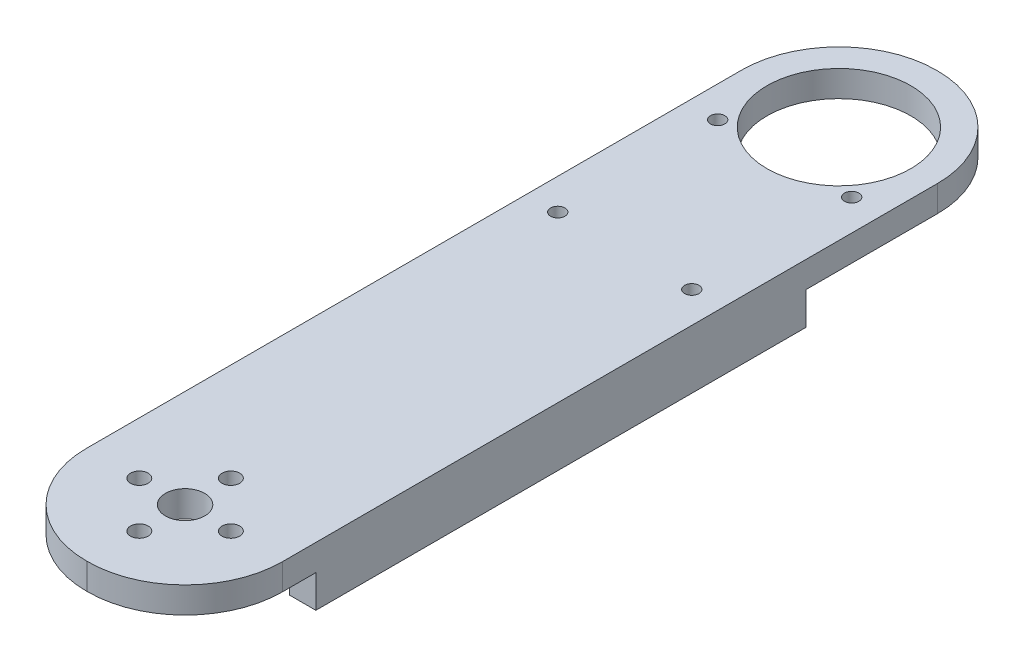
from build123d import *

# Parameters (mm, degrees)
BOSS_1_DEPTH  = 4
S_BOX2_W      = 4
S_BOX2_H      = 5.5
BOSS_2_DEPTH  = 75
S_BOX3_W      = 4
S_BOX3_H      = 5.5
BOSS_3_DEPTH  = 75
S_HOLE4_R     = 3
HOLE_4_DEPTH  = 4.2
S_HOLE5_R     = 1.35
HOLE_5_DEPTH  = 4.2
S_HOLE6_R     = 1.35
HOLE_6_DEPTH  = 4.2
S_HOLE7_R     = 1.35
HOLE_7_DEPTH  = 4.2
S_HOLE8_R     = 1.35
HOLE_8_DEPTH  = 4.2
S_HOLE9_R     = 11
HOLE_9_DEPTH  = 4.2
S_HOLE10_R    = 1.1
HOLE_10_DEPTH = 4.2
S_HOLE11_R    = 1.1
HOLE_11_DEPTH = 4.2
S_HOLE12_R    = 1.1
HOLE_12_DEPTH = 4.2
S_HOLE13_R    = 1.1
HOLE_13_DEPTH = 4.2


with BuildPart() as part:
    # S_prism1 → Boss_1 (new body)
    with BuildSketch(Plane(origin=(0, -22.625, 0), x_dir=(1, 0, 0), z_dir=(0, 1, 0))):
        with BuildLine():
            Line((-0.1, -15), (0.1, -15))
            ThreePointArc((0.1, -15), (10.6359, -10.6359), (15, -0.1))
            Line((15, -0.1), (15, 100.1))
            ThreePointArc((15, 100.1), (10.6359, 110.6359), (0.1, 115))
            Line((0.1, 115), (-0.1, 115))
            ThreePointArc((-0.1, 115), (-10.6359, 110.6359), (-15, 100.1))
            Line((-15, 100.1), (-15, -0.1))
            ThreePointArc((-15, -0.1), (-10.6359, -10.6359), (-0.1, -15))
        make_face()
    extrude(amount=BOSS_1_DEPTH)

    # S_box2 → Boss_2 (add)
    with BuildSketch(Plane.XY.offset(-80)):
        with Locations((-13, -24.875)):
            Rectangle(S_BOX2_W, S_BOX2_H)
    extrude(amount=BOSS_2_DEPTH)

    # S_box3 → Boss_3 (add)
    with BuildSketch(Plane.XY.offset(-80)):
        with Locations((13, -24.875)):
            Rectangle(S_BOX3_W, S_BOX3_H)
    extrude(amount=BOSS_3_DEPTH)

    # S_hole4 → Hole_4 (cut)
    with BuildSketch(Plane(origin=(0, -22.725, 0), x_dir=(1, 0, 0), z_dir=(0, 1, 0))):
        Circle(S_HOLE4_R)
    extrude(amount=HOLE_4_DEPTH, mode=Mode.SUBTRACT)

    # S_hole5 → Hole_5 (cut)
    with BuildSketch(Plane(origin=(0, -22.725, 0), x_dir=(1, 0, 0), z_dir=(0, 1, 0))):
        with Locations((7, 0)):
            Circle(S_HOLE5_R)
    extrude(amount=HOLE_5_DEPTH, mode=Mode.SUBTRACT)

    # S_hole6 → Hole_6 (cut)
    with BuildSketch(Plane(origin=(0, -22.725, 0), x_dir=(1, 0, 0), z_dir=(0, 1, 0))):
        with Locations((0, -7)):
            Circle(S_HOLE6_R)
    extrude(amount=HOLE_6_DEPTH, mode=Mode.SUBTRACT)

    # S_hole7 → Hole_7 (cut)
    with BuildSketch(Plane(origin=(0, -22.725, 0), x_dir=(1, 0, 0), z_dir=(0, 1, 0))):
        with Locations((-7, 0)):
            Circle(S_HOLE7_R)
    extrude(amount=HOLE_7_DEPTH, mode=Mode.SUBTRACT)

    # S_hole8 → Hole_8 (cut)
    with BuildSketch(Plane(origin=(0, -22.725, 0), x_dir=(1, 0, 0), z_dir=(0, 1, 0))):
        with Locations((0, 7)):
            Circle(S_HOLE8_R)
    extrude(amount=HOLE_8_DEPTH, mode=Mode.SUBTRACT)

    # S_hole9 → Hole_9 (cut)
    with BuildSketch(Plane(origin=(0, -22.725, 0), x_dir=(1, 0, 0), z_dir=(0, 1, 0))):
        with Locations((0, 100)):
            Circle(S_HOLE9_R)
    extrude(amount=HOLE_9_DEPTH, mode=Mode.SUBTRACT)

    # S_hole10 → Hole_10 (cut)
    with BuildSketch(Plane(origin=(0, -22.725, 0), x_dir=(1, 0, 0), z_dir=(0, 1, 0))):
        with Locations((-10.25, 91.7)):
            Circle(S_HOLE10_R)
    extrude(amount=HOLE_10_DEPTH, mode=Mode.SUBTRACT)

    # S_hole11 → Hole_11 (cut)
    with BuildSketch(Plane(origin=(0, -22.725, 0), x_dir=(1, 0, 0), z_dir=(0, 1, 0))):
        with Locations((10.25, 91.7)):
            Circle(S_HOLE11_R)
    extrude(amount=HOLE_11_DEPTH, mode=Mode.SUBTRACT)

    # S_hole12 → Hole_12 (cut)
    with BuildSketch(Plane(origin=(0, -22.725, 0), x_dir=(1, 0, 0), z_dir=(0, 1, 0))):
        with Locations((-10.25, 67.25)):
            Circle(S_HOLE12_R)
    extrude(amount=HOLE_12_DEPTH, mode=Mode.SUBTRACT)

    # S_hole13 → Hole_13 (cut)
    with BuildSketch(Plane(origin=(0, -22.725, 0), x_dir=(1, 0, 0), z_dir=(0, 1, 0))):
        with Locations((10.25, 67.25)):
            Circle(S_HOLE13_R)
    extrude(amount=HOLE_13_DEPTH, mode=Mode.SUBTRACT)


solid = part.part
